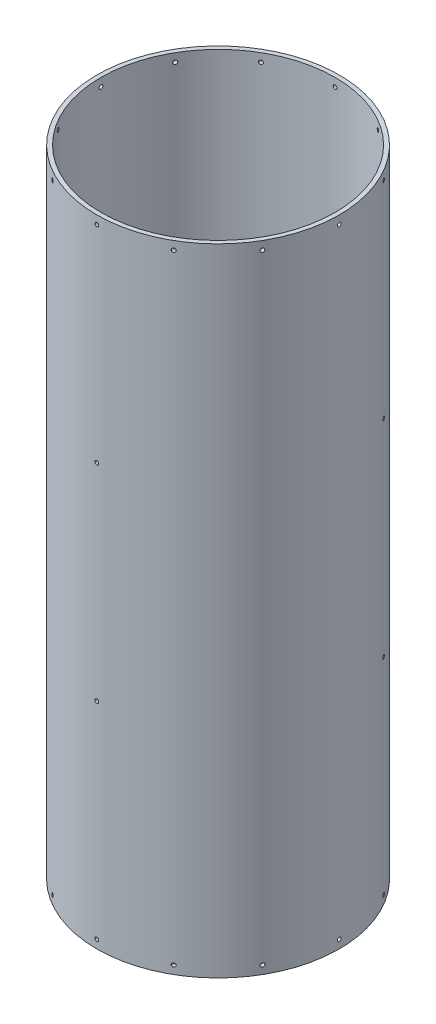
from build123d import *

# Parameters (mm, degrees)
SKETCH1_R                = 92.075
SKETCH1_R_2              = 88.9
BOSS_EXTRUDE1_DEPTH      = 241.427
SKETCH3_R                = 1.4351
CUT_EXTRUDE1_DEPTH       = 19.304
CIRPATTERN1_COUNT        = 12
MIRROR1_COPY_1_SKETCH_R  = 1.4351
MIRROR1_COPY_1_DEPTH     = 19.304
MIRROR1_COPY_2_SKETCH_R  = 1.4351
MIRROR1_COPY_2_DEPTH     = 19.304
MIRROR1_COPY_3_SKETCH_R  = 1.4351
MIRROR1_COPY_3_DEPTH     = 19.304
MIRROR1_COPY_4_SKETCH_R  = 1.4351
MIRROR1_COPY_4_DEPTH     = 19.304
MIRROR1_COPY_5_SKETCH_R  = 1.4351
MIRROR1_COPY_5_DEPTH     = 19.304
MIRROR1_COPY_6_SKETCH_R  = 1.4351
MIRROR1_COPY_6_DEPTH     = 19.304
MIRROR1_COPY_7_SKETCH_R  = 1.4351
MIRROR1_COPY_7_DEPTH     = 19.304
MIRROR1_COPY_8_SKETCH_R  = 1.4351
MIRROR1_COPY_8_DEPTH     = 19.304
MIRROR1_COPY_9_SKETCH_R  = 1.4351
MIRROR1_COPY_9_DEPTH     = 19.304
MIRROR1_COPY_10_SKETCH_R = 1.4351
MIRROR1_COPY_10_DEPTH    = 19.304
MIRROR1_COPY_11_SKETCH_R = 1.4351
MIRROR1_COPY_11_DEPTH    = 19.304
SKETCH4_R                = 1.4351
CUT_EXTRUDE2_DEPTH       = 25.146
CIRPATTERN2_COUNT        = 3


with BuildPart() as part:
    # Sketch1 → Boss-Extrude1 (new, symmetric)
    with BuildSketch(Plane(origin=(0, 0, 0), x_dir=(1, 0, 0), z_dir=(0, 1, 0))):
        Circle(SKETCH1_R)
        Circle(SKETCH1_R_2, mode=Mode.SUBTRACT)
    extrude(amount=BOSS_EXTRUDE1_DEPTH, both=True)

    # Sketch3 → Cut-Extrude1 (cut)
    with BuildSketch(Plane.XY.offset(92.075)):
        with Locations((0, -235.077)):
            Circle(SKETCH3_R)
    cut_extrude1 = extrude(amount=-CUT_EXTRUDE1_DEPTH, mode=Mode.SUBTRACT)

    # CirPattern1: Cut-Extrude1 ×12 about axis
    cirpattern1_axis = Axis((0, 241.427, 0), (0, -1, 0))
    for i in range(1, CIRPATTERN1_COUNT):
        add(cut_extrude1.rotate(cirpattern1_axis, i * 360 / CIRPATTERN1_COUNT), mode=Mode.SUBTRACT)

    # Mirror1: Cut-Extrude1 across plane
    add(cut_extrude1.mirror(Plane.ZX), mode=Mode.SUBTRACT)

    # Mirror1 copy 1 sketch → Mirror1 copy 1 (cut)
    with BuildSketch(Plane(origin=(-46.0375, 0, 79.739289053), x_dir=(0.8660254037844387, 0, 0.49999999999999994), z_dir=(-0.49999999999999994, 0, 0.8660254037844387))):
        with Locations((0, 235.077)):
            Circle(MIRROR1_COPY_1_SKETCH_R)
    extrude(amount=-MIRROR1_COPY_1_DEPTH, mode=Mode.SUBTRACT)

    # Mirror1 copy 2 sketch → Mirror1 copy 2 (cut)
    with BuildSketch(Plane(origin=(-79.739289053, 0, 46.0375), x_dir=(0.5000000000000001, 0, 0.8660254037844386), z_dir=(-0.8660254037844386, 0, 0.5000000000000001))):
        with Locations((0, 235.077)):
            Circle(MIRROR1_COPY_2_SKETCH_R)
    extrude(amount=-MIRROR1_COPY_2_DEPTH, mode=Mode.SUBTRACT)

    # Mirror1 copy 3 sketch → Mirror1 copy 3 (cut)
    with BuildSketch(Plane.ZY.offset(92.075)):
        with Locations((0, 235.077)):
            Circle(MIRROR1_COPY_3_SKETCH_R)
    extrude(amount=-MIRROR1_COPY_3_DEPTH, mode=Mode.SUBTRACT)

    # Mirror1 copy 4 sketch → Mirror1 copy 4 (cut)
    with BuildSketch(Plane(origin=(-79.739289053, 0, -46.0375), x_dir=(-0.4999999999999998, 0, 0.8660254037844387), z_dir=(-0.8660254037844387, 0, -0.4999999999999998))):
        with Locations((0, 235.077)):
            Circle(MIRROR1_COPY_4_SKETCH_R)
    extrude(amount=-MIRROR1_COPY_4_DEPTH, mode=Mode.SUBTRACT)

    # Mirror1 copy 5 sketch → Mirror1 copy 5 (cut)
    with BuildSketch(Plane(origin=(-46.0375, 0, -79.739289053), x_dir=(-0.8660254037844387, 0, 0.49999999999999994), z_dir=(-0.49999999999999994, 0, -0.8660254037844387))):
        with Locations((0, 235.077)):
            Circle(MIRROR1_COPY_5_SKETCH_R)
    extrude(amount=-MIRROR1_COPY_5_DEPTH, mode=Mode.SUBTRACT)

    # Mirror1 copy 6 sketch → Mirror1 copy 6 (cut)
    with BuildSketch(Plane(origin=(0, 0, -92.075), x_dir=(-1, 0, 0), z_dir=(0, 0, -1))):
        with Locations((0, 235.077)):
            Circle(MIRROR1_COPY_6_SKETCH_R)
    extrude(amount=-MIRROR1_COPY_6_DEPTH, mode=Mode.SUBTRACT)

    # Mirror1 copy 7 sketch → Mirror1 copy 7 (cut)
    with BuildSketch(Plane(origin=(46.0375, 0, -79.739289053), x_dir=(-0.8660254037844386, 0, -0.5000000000000001), z_dir=(0.5000000000000001, 0, -0.8660254037844386))):
        with Locations((0, 235.077)):
            Circle(MIRROR1_COPY_7_SKETCH_R)
    extrude(amount=-MIRROR1_COPY_7_DEPTH, mode=Mode.SUBTRACT)

    # Mirror1 copy 8 sketch → Mirror1 copy 8 (cut)
    with BuildSketch(Plane(origin=(79.739289053, 0, -46.0375), x_dir=(-0.5000000000000004, 0, -0.8660254037844384), z_dir=(0.8660254037844384, 0, -0.5000000000000004))):
        with Locations((0, 235.077)):
            Circle(MIRROR1_COPY_8_SKETCH_R)
    extrude(amount=-MIRROR1_COPY_8_DEPTH, mode=Mode.SUBTRACT)

    # Mirror1 copy 9 sketch → Mirror1 copy 9 (cut)
    with BuildSketch(Plane(origin=(92.075, 0, 0), x_dir=(0, 0, -1), z_dir=(1, 0, 0))):
        with Locations((0, 235.077)):
            Circle(MIRROR1_COPY_9_SKETCH_R)
    extrude(amount=-MIRROR1_COPY_9_DEPTH, mode=Mode.SUBTRACT)

    # Mirror1 copy 10 sketch → Mirror1 copy 10 (cut)
    with BuildSketch(Plane(origin=(79.739289053, 0, 46.0375), x_dir=(0.5000000000000001, 0, -0.8660254037844386), z_dir=(0.8660254037844386, 0, 0.5000000000000001))):
        with Locations((0, 235.077)):
            Circle(MIRROR1_COPY_10_SKETCH_R)
    extrude(amount=-MIRROR1_COPY_10_DEPTH, mode=Mode.SUBTRACT)

    # Mirror1 copy 11 sketch → Mirror1 copy 11 (cut)
    with BuildSketch(Plane(origin=(46.0375, 0, 79.739289053), x_dir=(0.8660254037844384, 0, -0.5000000000000004), z_dir=(0.5000000000000004, 0, 0.8660254037844384))):
        with Locations((0, 235.077)):
            Circle(MIRROR1_COPY_11_SKETCH_R)
    extrude(amount=-MIRROR1_COPY_11_DEPTH, mode=Mode.SUBTRACT)

    # Sketch4 → Cut-Extrude2 (cut)
    with BuildSketch(Plane.XY.offset(92.075)):
        with Locations((0, -78.359)):
            Circle(SKETCH4_R)
        with Locations((0, 78.359)):
            Circle(SKETCH4_R)
    cut_extrude2 = extrude(amount=-CUT_EXTRUDE2_DEPTH, mode=Mode.SUBTRACT)

    # CirPattern2: Cut-Extrude2 ×3 about axis
    cirpattern2_axis = Axis((0, 241.427, 0), (0, -1, 0))
    for i in range(1, CIRPATTERN2_COUNT):
        add(cut_extrude2.rotate(cirpattern2_axis, i * 360 / CIRPATTERN2_COUNT), mode=Mode.SUBTRACT)


solid = part.part
